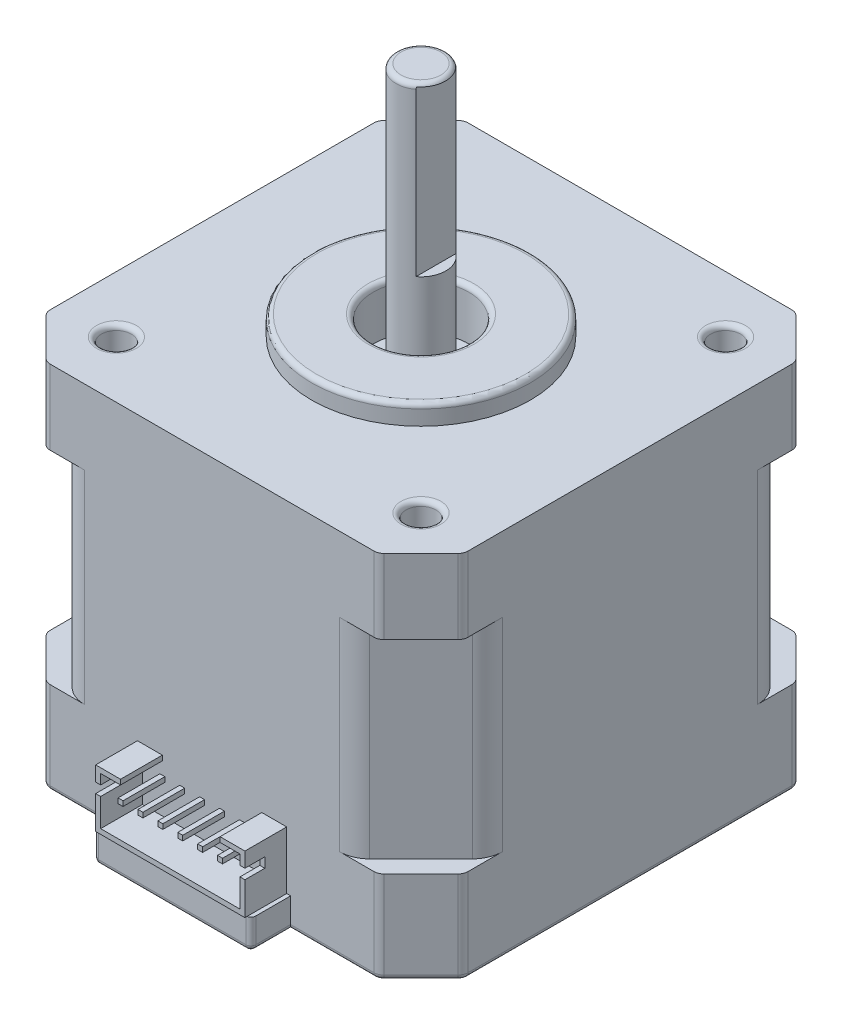
from build123d import *

# Parameters (mm, degrees)
BOSS_EXTRUDE1_DEPTH = 37.2
SKETCH2_R           = 11
BOSS_EXTRUDE2_DEPTH = 2
SKETCH3_R           = 2.5
BOSS_EXTRUDE3_DEPTH = 21.8
SKETCH5_R           = 1.5
CUT_EXTRUDE1_DEPTH  = 4.5
SKETCH7_R           = 3.1
CUT_EXTRUDE2_DEPTH  = 5
CUT_EXTRUDE3_DEPTH  = 20.4
SKETCH11_R          = 4.6
CUT_EXTRUDE4_DEPTH  = 4.3
SKETCH12_R          = 2.4
BOSS_EXTRUDE4_DEPTH = 2
CUT_EXTRUDE5_DEPTH  = 16.5
SKETCH15_W          = 15.8
SKETCH15_H          = 3
BOSS_EXTRUDE6_DEPTH = 4
SKETCH16_W          = 15
SKETCH16_H          = 5.8
BOSS_EXTRUDE7_DEPTH = 4.2
CUT_EXTRUDE6_DEPTH  = 4.2
SKETCH19_W          = 0.5
SKETCH19_H          = 1
CUT_EXTRUDE8_DEPTH  = 2
SKETCH20_W          = 0.5
SKETCH20_H          = 0.5
BOSS_EXTRUDE8_DEPTH = 4.2
SKETCH21_R          = 2.5
BOSS_EXTRUDE9_DEPTH = 4.5
CIRPATTERN1_COUNT   = 4
CUT_EXTRUDE12_START = -5
SKETCH22_R          = 4.8
SKETCH22_R_2        = 2.5
CUT_EXTRUDE12_DEPTH = 5
FILLET1_R           = 1
FILLET2_R           = 3
FILLET3_R           = 0.5
FILLET4_R           = 0.5
FILLET5_R           = 0.5
FILLET7_R           = 0.5
FILLET8_R           = 0.5


with BuildPart() as part:
    # Sketch1 → Boss-Extrude1 (new body)
    with BuildSketch(Plane(origin=(0, 0, 0), x_dir=(1, 0, 0), z_dir=(0, 1, 0))):
        Polygon((-16.686648635, -21), (16.686648635, -21), (21, -16.686648635), (21, 16.686648635), (16.686648635, 21), (-16.686648635, 21), (-21, 16.686648635), (-21, -16.686648635), align=None)
    extrude(amount=BOSS_EXTRUDE1_DEPTH)

    # Sketch2 → Boss-Extrude2 (add)
    with BuildSketch(Plane(origin=(0, 37.2, 0), x_dir=(1, 0, 0), z_dir=(0, 1, 0))):
        with Locations(Location((0, 0, 0), (0, 0, 90))):
            Circle(SKETCH2_R)
    extrude(amount=BOSS_EXTRUDE2_DEPTH)

    # Sketch3 → Boss-Extrude3 (add)
    with BuildSketch(Plane(origin=(0, 39.2, 0), x_dir=(1, 0, 0), z_dir=(0, 1, 0))):
        with Locations(Location((0, 0, 0), (0, 0, 270))):
            Circle(SKETCH3_R)
    extrude(amount=BOSS_EXTRUDE3_DEPTH)

    # Sketch5 → Cut-Extrude1 (cut)
    with BuildSketch(Plane(origin=(0, 37.2, 0), x_dir=(1, 0, 0), z_dir=(0, 1, 0))):
        with Locations(Location((15.307790411, 15.307790411, 0), (0, 0, 270))):
            Circle(SKETCH5_R)
        with Locations(Location((15.307790411, -15.307790411, 0), (0, 0, 270))):
            Circle(SKETCH5_R)
        with Locations(Location((-15.307790411, -15.307790411, 0), (0, 0, 270))):
            Circle(SKETCH5_R)
        with Locations(Location((-15.307790411, 15.307790411, 0), (0, 0, 270))):
            Circle(SKETCH5_R)
    extrude(amount=-CUT_EXTRUDE1_DEPTH, mode=Mode.SUBTRACT)

    # Sketch7 → Cut-Extrude2 (cut)
    with BuildSketch(Plane.XZ):
        with Locations(Location((15.237079733, -15.237079733, 0), (0, 0, 270))):
            Circle(SKETCH7_R)
        with Locations(Location((-15.237079733, -15.237079733, 0), (0, 0, 270))):
            Circle(SKETCH7_R)
        with Locations(Location((-15.237079733, 15.237079733, 0), (0, 0, 270))):
            Circle(SKETCH7_R)
        with Locations(Location((15.237079733, 15.237079733, 0), (0, 0, 270))):
            Circle(SKETCH7_R)
    extrude(amount=-CUT_EXTRUDE2_DEPTH, mode=Mode.SUBTRACT)

    # Sketch9 → Cut-Extrude3 (cut)
    with BuildSketch(Plane(origin=(0, 9.3, 0), x_dir=(1, 0, 0), z_dir=(0, 1, 0))):
        Polygon((14.070353544, 21), (21, 14.070353544), (21, 16.686648635), (16.686648635, 21), align=None)
        Polygon((21, -14.070353544), (14.070353544, -21), (16.686648635, -21), (21, -16.686648635), align=None)
        Polygon((-14.070353544, -21), (-21, -14.070353544), (-21, -16.686648635), (-16.686648635, -21), align=None)
        Polygon((-21, 14.070353544), (-14.070353544, 21), (-16.686648635, 21), (-21, 16.686648635), align=None)
    extrude(amount=CUT_EXTRUDE3_DEPTH, mode=Mode.SUBTRACT)

    # Sketch11 → Cut-Extrude4 (cut)
    with BuildSketch(Plane.XZ):
        with Locations(Location((0, 0, 0), (0, 0, 270))):
            Circle(SKETCH11_R)
    extrude(amount=-CUT_EXTRUDE4_DEPTH, mode=Mode.SUBTRACT)

    # Sketch12 → Boss-Extrude4 (add)
    with BuildSketch(Plane.XZ.offset(-4.3)):
        with Locations(Location((0, 0, 0), (0, 0, 270))):
            Circle(SKETCH12_R)
    extrude(amount=BOSS_EXTRUDE4_DEPTH)

    # Sketch13 → Cut-Extrude5 (cut)
    with BuildSketch(Plane(origin=(0, 44.2, 0), x_dir=(1, 0, 0), z_dir=(0, 1, 0))):
        with BuildLine():
            Line((1.5, -2), (1.5, 2))
            ThreePointArc((1.5, 2), (2.5, 0), (1.5, -2))
        make_face()
    extrude(amount=CUT_EXTRUDE5_DEPTH, mode=Mode.SUBTRACT)

    # Sketch15 → Boss-Extrude6 (add)
    with BuildSketch(Plane.XY.offset(21)):
        with Locations((0, 1.5)):
            Rectangle(SKETCH15_W, SKETCH15_H)
    extrude(amount=BOSS_EXTRUDE6_DEPTH)

    # Sketch16 → Boss-Extrude7 (add)
    with BuildSketch(Plane.XY.offset(21)):
        with Locations((0, 5.9)):
            Rectangle(SKETCH16_W, SKETCH16_H)
    extrude(amount=BOSS_EXTRUDE7_DEPTH)

    # Sketch18 → Cut-Extrude6 (cut)
    with BuildSketch(Plane.XY.offset(25.2)):
        Polygon((7, 8.3), (7, 3.5), (-7, 3.5), (-7, 8.3), (-5, 8.3), (-5, 8.8), (5, 8.8), (5, 8.3), align=None)
    extrude(amount=-CUT_EXTRUDE6_DEPTH, mode=Mode.SUBTRACT)

    # Sketch19 → Cut-Extrude8 (cut)
    with BuildSketch(Plane.XY.offset(25.2)):
        with Locations((-7.25, 6.8)):
            Rectangle(SKETCH19_W, SKETCH19_H)
        with Locations((7.25, 6.8)):
            Rectangle(SKETCH19_W, SKETCH19_H)
    extrude(amount=-CUT_EXTRUDE8_DEPTH, mode=Mode.SUBTRACT)

    # Sketch20 → Boss-Extrude8 (add)
    with BuildSketch(Plane.XY.offset(21)):
        with Locations((-3, 6.8)):
            Rectangle(SKETCH20_W, SKETCH20_H)
        with Locations((-5, 6.8)):
            Rectangle(SKETCH20_W, SKETCH20_H)
        with Locations((-1, 6.8)):
            Rectangle(SKETCH20_W, SKETCH20_H)
        with Locations((1, 6.8)):
            Rectangle(SKETCH20_W, SKETCH20_H)
        with Locations((3, 6.8)):
            Rectangle(SKETCH20_W, SKETCH20_H)
        with Locations((5, 6.8)):
            Rectangle(SKETCH20_W, SKETCH20_H)
    extrude(amount=BOSS_EXTRUDE8_DEPTH)

    # Sketch21 → Boss-Extrude9 (add)
    with BuildSketch(Plane.XZ.offset(-5)):
        with Locations(Location((-15.237079733, 15.237079733, 0), (0, 0, 270))):
            Circle(SKETCH21_R)
        with BuildLine():
            Line((-15.737079733, 16.987079733), (-15.737079733, 16.737079733))
            ThreePointArc((-15.737079733, 16.737079733), (-16.029972952, 16.029972952), (-16.737079733, 15.737079733))
            Line((-16.737079733, 15.737079733), (-16.987079733, 15.737079733))
            Line((-16.987079733, 15.737079733), (-16.987079733, 14.737079733))
            Line((-16.987079733, 14.737079733), (-16.737079733, 14.737079733))
            ThreePointArc((-16.737079733, 14.737079733), (-16.029972952, 14.444186515), (-15.737079733, 13.737079733))
            Line((-15.737079733, 13.737079733), (-15.737079733, 13.487079733))
            Line((-15.737079733, 13.487079733), (-14.737079733, 13.487079733))
            Line((-14.737079733, 13.487079733), (-14.737079733, 13.737079733))
            ThreePointArc((-14.737079733, 13.737079733), (-14.444186515, 14.444186515), (-13.737079733, 14.737079733))
            Line((-13.737079733, 14.737079733), (-13.487079733, 14.737079733))
            Line((-13.487079733, 14.737079733), (-13.487079733, 15.737079733))
            Line((-13.487079733, 15.737079733), (-13.737079733, 15.737079733))
            ThreePointArc((-13.737079733, 15.737079733), (-14.444186515, 16.029972952), (-14.737079733, 16.737079733))
            Line((-14.737079733, 16.737079733), (-14.737079733, 16.987079733))
            Line((-14.737079733, 16.987079733), (-15.737079733, 16.987079733))
        make_face(mode=Mode.SUBTRACT)
    boss_extrude9 = extrude(amount=BOSS_EXTRUDE9_DEPTH)

    # CirPattern1: Boss-Extrude9 ×4 about axis
    cirpattern1_axis = Axis((0, 0, 0), (0, 1, 0))
    for i in range(1, CIRPATTERN1_COUNT):
        add(boss_extrude9.rotate(cirpattern1_axis, i * 360 / CIRPATTERN1_COUNT))

    # Sketch22 → Cut-Extrude12 (cut)
    with BuildSketch(Plane(origin=(0, 39.2, 0), x_dir=(1, 0, 0), z_dir=(0, 1, 0)).offset(CUT_EXTRUDE12_START)):
        with Locations(Location((0, 0, 0), (0, 0, 270))):
            Circle(SKETCH22_R)
        with Locations(Location((0, 0, 0), (0, 0, 270))):
            Circle(SKETCH22_R_2, mode=Mode.SUBTRACT)
    extrude(amount=CUT_EXTRUDE12_DEPTH, mode=Mode.SUBTRACT)

    # Fillet1
    fillet1_edges = [part.edges().sort_by_distance(p)[0] for p in [
        (-16.686648635, 33.45, -21),
        (16.686648635, 33.45, -21),
        (21, 33.45, -16.686648635),
        (-16.686648635, 33.45, 21),
        (-21, 33.45, 16.686648635),
        (-21, 33.45, -16.686648635),
        (16.686648635, 33.45, 21),
        (-21, 4.65, -16.686648635),
        (-21, 4.65, 16.686648635),
        (-16.686648635, 4.65, 21),
        (21, 4.65, 16.686648635),
        (21, 4.65, -16.686648635),
        (16.686648635, 4.65, -21),
        (-16.686648635, 4.65, -21),
        (16.686648635, 4.65, 21),
        (21, 33.45, 16.686648635),
    ]]
    fillet(fillet1_edges, radius=FILLET1_R)

    # Fillet2
    fillet2_edges = [part.edges().sort_by_distance(p)[0] for p in [
        (-21, 19.5, -14.070353544),
        (-14.070353544, 19.5, -21),
        (14.070353544, 19.5, -21),
        (21, 19.5, -14.070353544),
        (21, 19.5, 14.070353544),
        (14.070353544, 19.5, 21),
        (-14.070353544, 19.5, 21),
        (-21, 19.5, 14.070353544),
    ]]
    fillet(fillet2_edges, radius=FILLET2_R)

    # Fillet3
    fillet3_edges = [part.edges().sort_by_distance(p)[0] for p in [
        (0, 39.2, 11),
        (15.307790411, 37.2, -16.807790411),
        (15.307790411, 37.2, 13.807790411),
        (-15.307790411, 37.2, 13.807790411),
        (-15.307790411, 37.2, -16.807790411),
    ]]
    fillet(fillet3_edges, radius=FILLET3_R)

    # Fillet4
    fillet4_edges = [part.edges().sort_by_distance(p)[0] for p in [
        (0, 0, 4.6),
        (15.237079733, 0, 18.337079733),
        (15.237079733, 0, -12.137079733),
        (-15.237079733, 0, -12.137079733),
        (-15.237079733, 0, 18.337079733),
    ]]
    fillet(fillet4_edges, radius=FILLET4_R)

    # Fillet5
    # the kernel refuses this fillet: 0.5 mm, written as the material it takes off along each edge
    with BuildSketch(Plane(origin=(0, 61, 0), x_dir=(0, 0, 1), z_dir=(-1, 0, 0))) as fillet5_piece_1:
        with BuildLine():
            CenterArc((2.5 - FILLET5_R, -FILLET5_R), FILLET5_R, 0, 90)
            Line((2.5 - FILLET5_R, 0), (2.5, 0))
            Line((2.5, 0), (2.5, -FILLET5_R))
        make_face()
    revolve(axis=Axis((0, 61, 0), (0, 1, 0)), mode=Mode.SUBTRACT)

    # Fillet7
    # the kernel refuses this fillet: 0.5 mm, written as the material it takes off along each edge
    with BuildSketch(Plane(origin=(-7.4, 0.5, 24.5), x_dir=(-1, 0, 0), z_dir=(0, -1, 0))) as fillet7_piece_1_section:
        Polygon((0, 0), (FILLET7_R * 1.02, 0), (FILLET7_R * 1.02, -FILLET7_R * 1.02), (0, -FILLET7_R * 1.02), align=None)
    fillet7_piece_1 = extrude(amount=FILLET7_R * 1.02, mode=Mode.PRIVATE)
    fillet7_piece_1 = fillet7_piece_1 - Plane(origin=(-7.4, 0.5, 24.5), x_dir=(0.7071067811865475, 0, -0.7071067811865475), z_dir=(0, -1, 0)) * Sphere(FILLET7_R, mode=Mode.PRIVATE)
    add(fillet7_piece_1, mode=Mode.SUBTRACT)
    with BuildSketch(Plane(origin=(7.4, 0.5, 24.5), x_dir=(1, 0, 0), z_dir=(0, -1, 0))) as fillet7_piece_2_section:
        Polygon((0, 0), (FILLET7_R * 1.02, 0), (FILLET7_R * 1.02, FILLET7_R * 1.02), (0, FILLET7_R * 1.02), align=None)
    fillet7_piece_2 = extrude(amount=FILLET7_R * 1.02, mode=Mode.PRIVATE)
    fillet7_piece_2 = fillet7_piece_2 - Plane(origin=(7.4, 0.5, 24.5), x_dir=(-0.7071067811865475, 0, -0.7071067811865475), z_dir=(0, -1, 0)) * Sphere(FILLET7_R, mode=Mode.PRIVATE)
    add(fillet7_piece_2, mode=Mode.SUBTRACT)
    with BuildSketch(Plane(origin=(-20, 0, 16.272435072), x_dir=(-1, 0, 0), z_dir=(0, 0, -1))) as fillet7_piece_3:
        with BuildLine():
            CenterArc((1 - FILLET7_R, FILLET7_R), FILLET7_R, 270, 90)
            Line((1, FILLET7_R), (1 + FILLET7_R * 0.02, FILLET7_R))
            Line((1 + FILLET7_R * 0.02, FILLET7_R), (1 + FILLET7_R * 0.02, -FILLET7_R * 0.02))
            Line((1 + FILLET7_R * 0.02, -FILLET7_R * 0.02), (1 - FILLET7_R, -FILLET7_R * 0.02))
            Line((1 - FILLET7_R, -FILLET7_R * 0.02), (1 - FILLET7_R, 0))
        make_face()
    revolve(axis=Axis((-20, 0, 16.272435072), (0, 1, 0)), revolution_arc=45, mode=Mode.SUBTRACT)
    with BuildSketch(Plane(origin=(-20.707106781, 0, 16.979541854), x_dir=(0.7071067811865474, 0, -0.7071067811865478), z_dir=(0.7071067811865479, 0, 0.7071067811865474)), Plane(origin=(16.979541854, 0, 20.707106781), x_dir=(-0.7071067811865474, 0, -0.7071067811865478), z_dir=(0.7071067811865479, 0, -0.7071067811865474)), Plane(origin=(20.707106781, 0, -16.979541854), x_dir=(-0.7071067811865476, 0, 0.7071067811865476), z_dir=(-0.7071067811865476, 0, -0.7071067811865476)), Plane(origin=(-16.979541854, 0, -20.707106781), x_dir=(0.7071067811865474, 0, 0.7071067811865478), z_dir=(-0.7071067811865479, 0, 0.7071067811865474))) as fillet7_piece_4:
        with BuildLine():
            CenterArc((FILLET7_R, FILLET7_R), FILLET7_R, 180, 90)
            Line((0, FILLET7_R), (-FILLET7_R * 0.02, FILLET7_R))
            Line((-FILLET7_R * 0.02, FILLET7_R), (-FILLET7_R * 0.02, -FILLET7_R * 0.02))
            Line((-FILLET7_R * 0.02, -FILLET7_R * 0.02), (FILLET7_R, -FILLET7_R * 0.02))
            Line((FILLET7_R, -FILLET7_R * 0.02), (FILLET7_R, 0))
        make_face()
    extrude(amount=5.271572875, mode=Mode.SUBTRACT)
    with BuildSketch(Plane(origin=(-16.272435072, 0, 20), x_dir=(0, 0, 1), z_dir=(1, 0, 0))) as fillet7_piece_5:
        with BuildLine():
            CenterArc((1 - FILLET7_R, -FILLET7_R), FILLET7_R, 0, 90)
            Line((1, -FILLET7_R), (1 + FILLET7_R * 0.02, -FILLET7_R))
            Line((1 + FILLET7_R * 0.02, -FILLET7_R), (1 + FILLET7_R * 0.02, FILLET7_R * 0.02))
            Line((1 + FILLET7_R * 0.02, FILLET7_R * 0.02), (1 - FILLET7_R, FILLET7_R * 0.02))
            Line((1 - FILLET7_R, FILLET7_R * 0.02), (1 - FILLET7_R, 0))
        make_face()
    revolve(axis=Axis((-16.272435072, 0, 20), (0, -1, 0)), revolution_arc=45, mode=Mode.SUBTRACT)
    with BuildSketch(Plane(origin=(-16.272435072, 0, 21), x_dir=(0, 0, -1), z_dir=(1, 0, 0)), Plane(origin=(7.9, 0, 21), x_dir=(0, 0, -1), z_dir=(1, 0, 0))) as fillet7_piece_6:
        with BuildLine():
            CenterArc((FILLET7_R, FILLET7_R), FILLET7_R, 180, 90)
            Line((0, FILLET7_R), (-FILLET7_R * 0.02, FILLET7_R))
            Line((-FILLET7_R * 0.02, FILLET7_R), (-FILLET7_R * 0.02, -FILLET7_R * 0.02))
            Line((-FILLET7_R * 0.02, -FILLET7_R * 0.02), (FILLET7_R, -FILLET7_R * 0.02))
            Line((FILLET7_R, -FILLET7_R * 0.02), (FILLET7_R, 0))
        make_face()
    extrude(amount=8.372435072, mode=Mode.SUBTRACT)
    with BuildSketch(Plane(origin=(-7.9, 0, 21), x_dir=(1, 0, 0), z_dir=(0, 0, 1))) as fillet7_piece_7:
        with BuildLine():
            CenterArc((FILLET7_R, FILLET7_R), FILLET7_R, 180, 90)
            Line((0, FILLET7_R), (-FILLET7_R * 0.02, FILLET7_R))
            Line((-FILLET7_R * 0.02, FILLET7_R), (-FILLET7_R * 0.02, -FILLET7_R * 0.02))
            Line((-FILLET7_R * 0.02, -FILLET7_R * 0.02), (FILLET7_R, -FILLET7_R * 0.02))
            Line((FILLET7_R, -FILLET7_R * 0.02), (FILLET7_R, 0))
        make_face()
    extrude(amount=3.5, mode=Mode.SUBTRACT)
    with BuildSketch(Plane(origin=(-7.4, 0, 25), x_dir=(0, 0, -1), z_dir=(1, 0, 0))) as fillet7_piece_8:
        with BuildLine():
            CenterArc((FILLET7_R, FILLET7_R), FILLET7_R, 180, 90)
            Line((0, FILLET7_R), (-FILLET7_R * 0.02, FILLET7_R))
            Line((-FILLET7_R * 0.02, FILLET7_R), (-FILLET7_R * 0.02, -FILLET7_R * 0.02))
            Line((-FILLET7_R * 0.02, -FILLET7_R * 0.02), (FILLET7_R, -FILLET7_R * 0.02))
            Line((FILLET7_R, -FILLET7_R * 0.02), (FILLET7_R, 0))
        make_face()
    extrude(amount=14.8, mode=Mode.SUBTRACT)
    with BuildSketch(Plane(origin=(7.9, 0, 21), x_dir=(-1, 0, 0), z_dir=(0, 0, 1))) as fillet7_piece_9:
        with BuildLine():
            CenterArc((FILLET7_R, -FILLET7_R), FILLET7_R, 90, 90)
            Line((0, -FILLET7_R), (-FILLET7_R * 0.02, -FILLET7_R))
            Line((-FILLET7_R * 0.02, -FILLET7_R), (-FILLET7_R * 0.02, FILLET7_R * 0.02))
            Line((-FILLET7_R * 0.02, FILLET7_R * 0.02), (FILLET7_R, FILLET7_R * 0.02))
            Line((FILLET7_R, FILLET7_R * 0.02), (FILLET7_R, 0))
        make_face()
    extrude(amount=3.5, mode=Mode.SUBTRACT)
    with BuildSketch(Plane(origin=(16.272435072, 0, 20), x_dir=(0, 0, 1), z_dir=(-1, 0, 0))) as fillet7_piece_10:
        with BuildLine():
            CenterArc((1 - FILLET7_R, FILLET7_R), FILLET7_R, 270, 90)
            Line((1, FILLET7_R), (1 + FILLET7_R * 0.02, FILLET7_R))
            Line((1 + FILLET7_R * 0.02, FILLET7_R), (1 + FILLET7_R * 0.02, -FILLET7_R * 0.02))
            Line((1 + FILLET7_R * 0.02, -FILLET7_R * 0.02), (1 - FILLET7_R, -FILLET7_R * 0.02))
            Line((1 - FILLET7_R, -FILLET7_R * 0.02), (1 - FILLET7_R, 0))
        make_face()
    revolve(axis=Axis((16.272435072, 0, 20), (0, 1, 0)), revolution_arc=45, mode=Mode.SUBTRACT)
    with BuildSketch(Plane(origin=(20, 0, 16.272435072), x_dir=(0.7071067811865476, 0, 0.7071067811865476), z_dir=(-0.7071067811865476, 0, 0.7071067811865476))) as fillet7_piece_11:
        with BuildLine():
            CenterArc((1 - FILLET7_R, FILLET7_R), FILLET7_R, 270, 90)
            Line((1, FILLET7_R), (1 + FILLET7_R * 0.02, FILLET7_R))
            Line((1 + FILLET7_R * 0.02, FILLET7_R), (1 + FILLET7_R * 0.02, -FILLET7_R * 0.02))
            Line((1 + FILLET7_R * 0.02, -FILLET7_R * 0.02), (1 - FILLET7_R, -FILLET7_R * 0.02))
            Line((1 - FILLET7_R, -FILLET7_R * 0.02), (1 - FILLET7_R, 0))
        make_face()
    revolve(axis=Axis((20, 0, 16.272435072), (0, 1, 0)), revolution_arc=45, mode=Mode.SUBTRACT)
    with BuildSketch(Plane(origin=(20, 0, -16.272435072), x_dir=(1, 0, 0), z_dir=(0, 0, 1))) as fillet7_piece_12:
        with BuildLine():
            CenterArc((1 - FILLET7_R, FILLET7_R), FILLET7_R, 270, 90)
            Line((1, FILLET7_R), (1 + FILLET7_R * 0.02, FILLET7_R))
            Line((1 + FILLET7_R * 0.02, FILLET7_R), (1 + FILLET7_R * 0.02, -FILLET7_R * 0.02))
            Line((1 + FILLET7_R * 0.02, -FILLET7_R * 0.02), (1 - FILLET7_R, -FILLET7_R * 0.02))
            Line((1 - FILLET7_R, -FILLET7_R * 0.02), (1 - FILLET7_R, 0))
        make_face()
    revolve(axis=Axis((20, 0, -16.272435072), (0, 1, 0)), revolution_arc=45, mode=Mode.SUBTRACT)
    with BuildSketch(Plane(origin=(16.272435072, 0, -20), x_dir=(0, 0, -1), z_dir=(-1, 0, 0))) as fillet7_piece_13:
        with BuildLine():
            CenterArc((1 - FILLET7_R, -FILLET7_R), FILLET7_R, 0, 90)
            Line((1, -FILLET7_R), (1 + FILLET7_R * 0.02, -FILLET7_R))
            Line((1 + FILLET7_R * 0.02, -FILLET7_R), (1 + FILLET7_R * 0.02, FILLET7_R * 0.02))
            Line((1 + FILLET7_R * 0.02, FILLET7_R * 0.02), (1 - FILLET7_R, FILLET7_R * 0.02))
            Line((1 - FILLET7_R, FILLET7_R * 0.02), (1 - FILLET7_R, 0))
        make_face()
    revolve(axis=Axis((16.272435072, 0, -20), (0, -1, 0)), revolution_arc=45, mode=Mode.SUBTRACT)
    with BuildSketch(Plane(origin=(16.272435072, 0, -21), x_dir=(0, 0, 1), z_dir=(-1, 0, 0)), Plane(origin=(-21, 0, -16.272435072), x_dir=(1, 0, 0), z_dir=(0, 0, 1)), Plane(origin=(21, 0, 16.272435072), x_dir=(-1, 0, 0), z_dir=(0, 0, -1))) as fillet7_piece_14:
        with BuildLine():
            CenterArc((FILLET7_R, FILLET7_R), FILLET7_R, 180, 90)
            Line((0, FILLET7_R), (-FILLET7_R * 0.02, FILLET7_R))
            Line((-FILLET7_R * 0.02, FILLET7_R), (-FILLET7_R * 0.02, -FILLET7_R * 0.02))
            Line((-FILLET7_R * 0.02, -FILLET7_R * 0.02), (FILLET7_R, -FILLET7_R * 0.02))
            Line((FILLET7_R, -FILLET7_R * 0.02), (FILLET7_R, 0))
        make_face()
    extrude(amount=32.544870145, mode=Mode.SUBTRACT)
    with BuildSketch(Plane(origin=(-16.272435072, 0, -20), x_dir=(0, 0, -1), z_dir=(1, 0, 0))) as fillet7_piece_15:
        with BuildLine():
            CenterArc((1 - FILLET7_R, FILLET7_R), FILLET7_R, 270, 90)
            Line((1, FILLET7_R), (1 + FILLET7_R * 0.02, FILLET7_R))
            Line((1 + FILLET7_R * 0.02, FILLET7_R), (1 + FILLET7_R * 0.02, -FILLET7_R * 0.02))
            Line((1 + FILLET7_R * 0.02, -FILLET7_R * 0.02), (1 - FILLET7_R, -FILLET7_R * 0.02))
            Line((1 - FILLET7_R, -FILLET7_R * 0.02), (1 - FILLET7_R, 0))
        make_face()
    revolve(axis=Axis((-16.272435072, 0, -20), (0, 1, 0)), revolution_arc=45, mode=Mode.SUBTRACT)
    with BuildSketch(Plane(origin=(-20, 0, -16.272435072), x_dir=(-1, 0, 0), z_dir=(0, 0, 1))) as fillet7_piece_16:
        with BuildLine():
            CenterArc((1 - FILLET7_R, -FILLET7_R), FILLET7_R, 0, 90)
            Line((1, -FILLET7_R), (1 + FILLET7_R * 0.02, -FILLET7_R))
            Line((1 + FILLET7_R * 0.02, -FILLET7_R), (1 + FILLET7_R * 0.02, FILLET7_R * 0.02))
            Line((1 + FILLET7_R * 0.02, FILLET7_R * 0.02), (1 - FILLET7_R, FILLET7_R * 0.02))
            Line((1 - FILLET7_R, FILLET7_R * 0.02), (1 - FILLET7_R, 0))
        make_face()
    revolve(axis=Axis((-20, 0, -16.272435072), (0, -1, 0)), revolution_arc=45, mode=Mode.SUBTRACT)
    with BuildSketch(Plane(origin=(7.9, 0.5, 25), x_dir=(-1, 0, 0), z_dir=(0, 1, 0))) as fillet7_piece_17:
        with BuildLine():
            CenterArc((FILLET7_R, -FILLET7_R), FILLET7_R, 90, 90)
            Line((0, -FILLET7_R), (-FILLET7_R * 0.02, -FILLET7_R))
            Line((-FILLET7_R * 0.02, -FILLET7_R), (-FILLET7_R * 0.02, FILLET7_R * 0.02))
            Line((-FILLET7_R * 0.02, FILLET7_R * 0.02), (FILLET7_R, FILLET7_R * 0.02))
            Line((FILLET7_R, FILLET7_R * 0.02), (FILLET7_R, 0))
        make_face()
    extrude(amount=2.5, mode=Mode.SUBTRACT)
    with BuildSketch(Plane(origin=(-7.9, 3, 25), x_dir=(0, 0, -1), z_dir=(0, -1, 0))) as fillet7_piece_18:
        with BuildLine():
            CenterArc((FILLET7_R, FILLET7_R), FILLET7_R, 180, 90)
            Line((0, FILLET7_R), (-FILLET7_R * 0.02, FILLET7_R))
            Line((-FILLET7_R * 0.02, FILLET7_R), (-FILLET7_R * 0.02, -FILLET7_R * 0.02))
            Line((-FILLET7_R * 0.02, -FILLET7_R * 0.02), (FILLET7_R, -FILLET7_R * 0.02))
            Line((FILLET7_R, -FILLET7_R * 0.02), (FILLET7_R, 0))
        make_face()
    extrude(amount=2.5, mode=Mode.SUBTRACT)
    with BuildSketch(Plane(origin=(-16.272435072, 0, 21), x_dir=(0, 0, -1), z_dir=(1, 0, 0))) as fillet7_piece_19a_section:
        with BuildLine():
            CenterArc((FILLET7_R, FILLET7_R), FILLET7_R, 180, 90)
            Line((0, FILLET7_R), (-FILLET7_R * 0.02, FILLET7_R))
            Line((-FILLET7_R * 0.02, FILLET7_R), (-FILLET7_R * 0.02, -FILLET7_R * 0.02))
            Line((-FILLET7_R * 0.02, -FILLET7_R * 0.02), (FILLET7_R, -FILLET7_R * 0.02))
            Line((FILLET7_R, -FILLET7_R * 0.02), (FILLET7_R, 0))
        make_face()
    fillet7_piece_19a = extrude(amount=9.622435072, mode=Mode.PRIVATE)
    fillet7_piece_19a = split(fillet7_piece_19a, bisect_by=Plane(origin=(-7.9, 0.113197557, 20.886802443), z_dir=(1, 0, 0)), keep=Keep.TOP, mode=Mode.PRIVATE)
    with BuildSketch(Plane(origin=(-7.9, 0, 19.75), x_dir=(1, 0, 0), z_dir=(0, 0, 1))) as fillet7_piece_19b_section:
        with BuildLine():
            CenterArc((FILLET7_R, FILLET7_R), FILLET7_R, 180, 90)
            Line((0, FILLET7_R), (-FILLET7_R * 0.02, FILLET7_R))
            Line((-FILLET7_R * 0.02, FILLET7_R), (-FILLET7_R * 0.02, -FILLET7_R * 0.02))
            Line((-FILLET7_R * 0.02, -FILLET7_R * 0.02), (FILLET7_R, -FILLET7_R * 0.02))
            Line((FILLET7_R, -FILLET7_R * 0.02), (FILLET7_R, 0))
        make_face()
    fillet7_piece_19b = extrude(amount=4.75, mode=Mode.PRIVATE)
    fillet7_piece_19b = split(fillet7_piece_19b, bisect_by=Plane(origin=(-7.786802443, 0.113197557, 21), z_dir=(0, 0, -1)), keep=Keep.TOP, mode=Mode.PRIVATE)
    fillet7_piece_19 = fillet7_piece_19a & fillet7_piece_19b
    add(fillet7_piece_19, mode=Mode.SUBTRACT)
    with BuildSketch(Plane(origin=(7.9, 0, 19.75), x_dir=(-1, 0, 0), z_dir=(0, 0, 1))) as fillet7_piece_20a_section:
        with BuildLine():
            CenterArc((FILLET7_R, -FILLET7_R), FILLET7_R, 90, 90)
            Line((0, -FILLET7_R), (-FILLET7_R * 0.02, -FILLET7_R))
            Line((-FILLET7_R * 0.02, -FILLET7_R), (-FILLET7_R * 0.02, FILLET7_R * 0.02))
            Line((-FILLET7_R * 0.02, FILLET7_R * 0.02), (FILLET7_R, FILLET7_R * 0.02))
            Line((FILLET7_R, FILLET7_R * 0.02), (FILLET7_R, 0))
        make_face()
    fillet7_piece_20a = extrude(amount=4.75, mode=Mode.PRIVATE)
    fillet7_piece_20a = split(fillet7_piece_20a, bisect_by=Plane(origin=(7.786802443, 0.113197557, 21), z_dir=(0, 0, -1)), keep=Keep.TOP, mode=Mode.PRIVATE)
    with BuildSketch(Plane(origin=(6.65, 0, 21), x_dir=(0, 0, -1), z_dir=(1, 0, 0))) as fillet7_piece_20b_section:
        with BuildLine():
            CenterArc((FILLET7_R, FILLET7_R), FILLET7_R, 180, 90)
            Line((0, FILLET7_R), (-FILLET7_R * 0.02, FILLET7_R))
            Line((-FILLET7_R * 0.02, FILLET7_R), (-FILLET7_R * 0.02, -FILLET7_R * 0.02))
            Line((-FILLET7_R * 0.02, -FILLET7_R * 0.02), (FILLET7_R, -FILLET7_R * 0.02))
            Line((FILLET7_R, -FILLET7_R * 0.02), (FILLET7_R, 0))
        make_face()
    fillet7_piece_20b = extrude(amount=9.622435072, mode=Mode.PRIVATE)
    fillet7_piece_20b = split(fillet7_piece_20b, bisect_by=Plane(origin=(7.9, 0.113197557, 20.886802443), z_dir=(-1, 0, 0)), keep=Keep.TOP, mode=Mode.PRIVATE)
    fillet7_piece_20 = fillet7_piece_20a & fillet7_piece_20b
    add(fillet7_piece_20, mode=Mode.SUBTRACT)

    # Fillet8
    fillet8_edges = [part.edges().sort_by_distance(p)[0] for p in [
        (0, 39.2, -4.8),
    ]]
    fillet(fillet8_edges, radius=FILLET8_R)


solid = part.part
